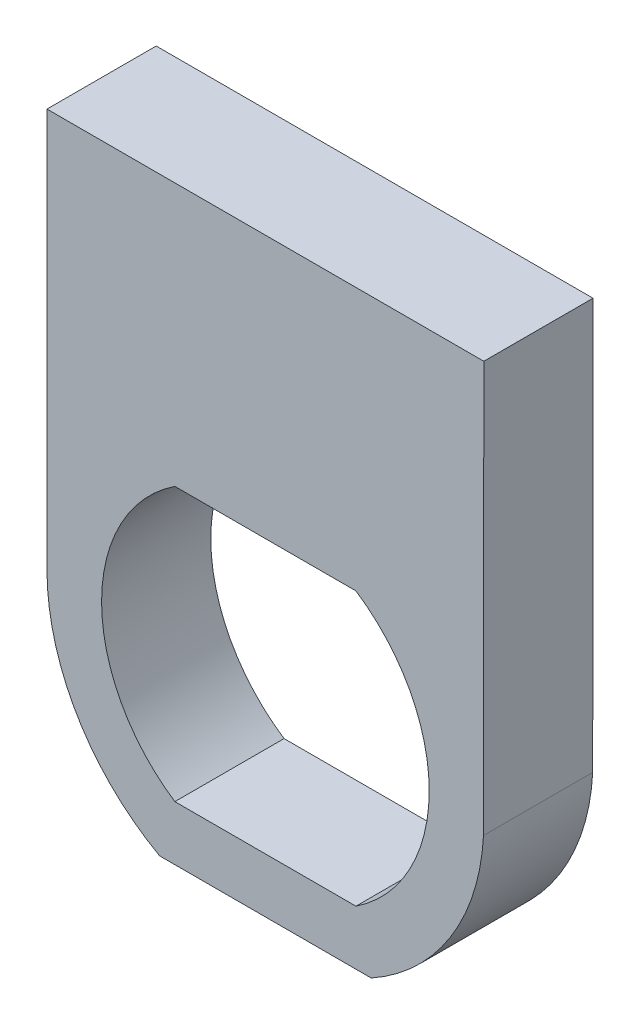
from build123d import *

# Parameters (mm, degrees)
BOSS_EXTRUDE1_DEPTH = 4


with BuildPart() as part:
    # Sketch1 → Boss-Extrude1 (new body)
    with BuildSketch(Plane.XY):
        with BuildLine():
            Line((-3.872983346, -7), (3.872983346, -7))
            ThreePointArc((3.872983346, -7), (6.782144643, -4.24293696), (7.98892235, -0.420855901))
            Line((7.98892235, -0.420855901), (7.989533332, 0.409093072))
            Line((7.989533332, 0.409093072), (8, 14.626863409))
            Line((8, 14.626863409), (-8, 14.626863409))
            Line((-8, 14.626863409), (-8, 0))
            ThreePointArc((-8, 0), (-6.891439137, -4.063012013), (-3.872983346, -7))
        make_face()
        with BuildLine():
            ThreePointArc((3.31662479, 5), (6, 0), (3.31662479, -5))
            Line((3.31662479, -5), (-3.31662479, -5))
            ThreePointArc((-3.31662479, -5), (-6, 0), (-3.31662479, 5))
            Line((-3.31662479, 5), (3.31662479, 5))
        make_face(mode=Mode.SUBTRACT)
    extrude(amount=BOSS_EXTRUDE1_DEPTH)


solid = part.part
